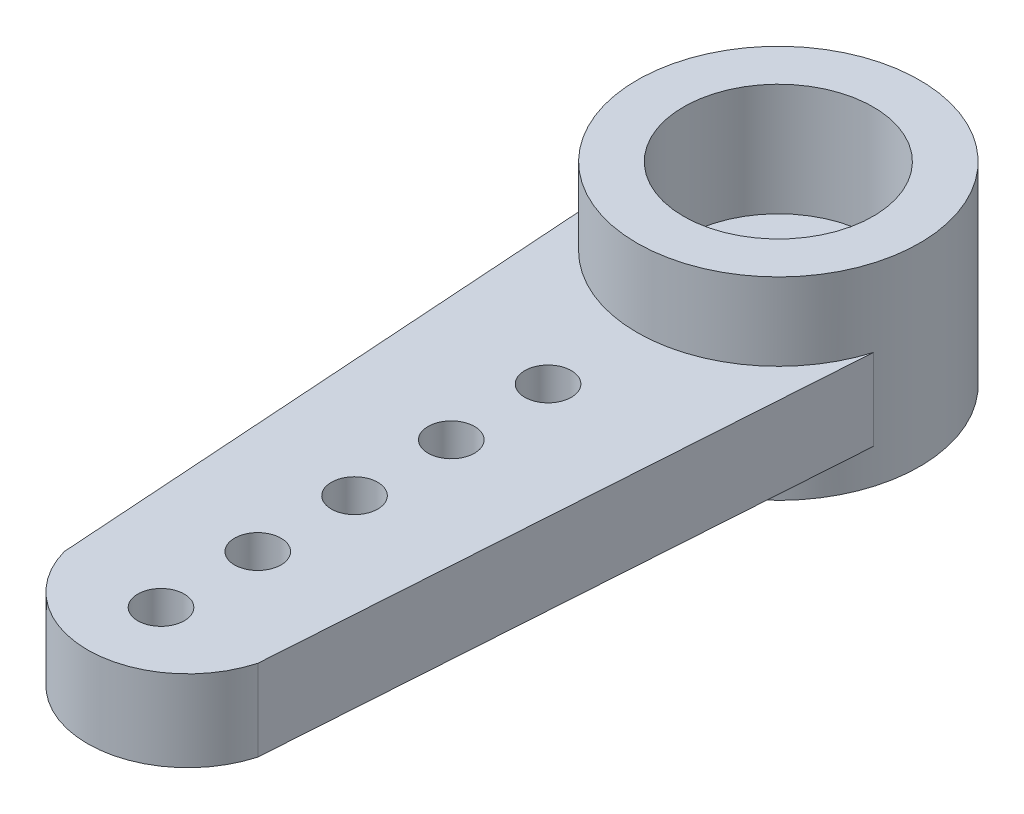
from build123d import *

# Parameters (mm, degrees)
SKETCH_3_R          = 3.65
EXTRUDE_1_DEPTH     = 2.5
SKETCH_4_R          = 2.45
CUT_EXTRUDE_1_DEPTH = 2.9
SKETCH_5_R          = 1.3
CUT_EXTRUDE_2_DEPTH = 6.920726307
EXTRUDE_2_DEPTH     = 2.1
SKETCH_7_R          = 0.6
CUT_EXTRUDE_3_DEPTH = 10


with BuildPart() as part:
    # 草图3 → 凸台-拉伸1 (new, symmetric)
    with BuildSketch(Plane(origin=(0, 0, 0), x_dir=(1, 0, 0), z_dir=(0, 1, 0))):
        Circle(SKETCH_3_R)
    extrude(amount=EXTRUDE_1_DEPTH, both=True)

    # 草图4 → 切除-拉伸1 (cut)
    with BuildSketch(Plane(origin=(0, 2.5, 0), x_dir=(1, 0, 0), z_dir=(0, 1, 0))):
        Circle(SKETCH_4_R)
    extrude(amount=-CUT_EXTRUDE_1_DEPTH, mode=Mode.SUBTRACT)

    # 草图5 → 切除-拉伸2 (cut, through all)
    with BuildSketch(Plane(origin=(0, -0.4, 0), x_dir=(1, 0, 0), z_dir=(0, 1, 0))):
        Circle(SKETCH_5_R)
    extrude(amount=-CUT_EXTRUDE_2_DEPTH, mode=Mode.SUBTRACT)

    # 草图6 → 凸台-拉伸2 (add)
    with BuildSketch(Plane(origin=(0, 0.5, 0), x_dir=(1, 0, 0), z_dir=(0, 1, 0))):
        with BuildLine():
            Line((3.5, -1.035615759), (2.5, -15.95))
            ThreePointArc((2.5, -15.95), (0, -17.85), (-2.5, -15.95))
            Line((-2.5, -15.95), (-3.5, -1.035615759))
            ThreePointArc((-3.5, -1.035615759), (0, -3.65), (3.5, -1.035615759))
        make_face()
    extrude(amount=-EXTRUDE_2_DEPTH)

    # 草图7 → 切除-拉伸3 (cut)
    with BuildSketch(Plane(origin=(0, 0.5, 0), x_dir=(1, 0, 0), z_dir=(0, 1, 0))):
        with Locations((0, -15.95)):
            Circle(SKETCH_7_R)
        with Locations((0, -13.45)):
            Circle(SKETCH_7_R)
        with Locations((0, -10.95)):
            Circle(SKETCH_7_R)
        with Locations((0, -8.45)):
            Circle(SKETCH_7_R)
        with Locations((0, -5.95)):
            Circle(SKETCH_7_R)
    extrude(amount=-CUT_EXTRUDE_3_DEPTH, mode=Mode.SUBTRACT)


solid = part.part
